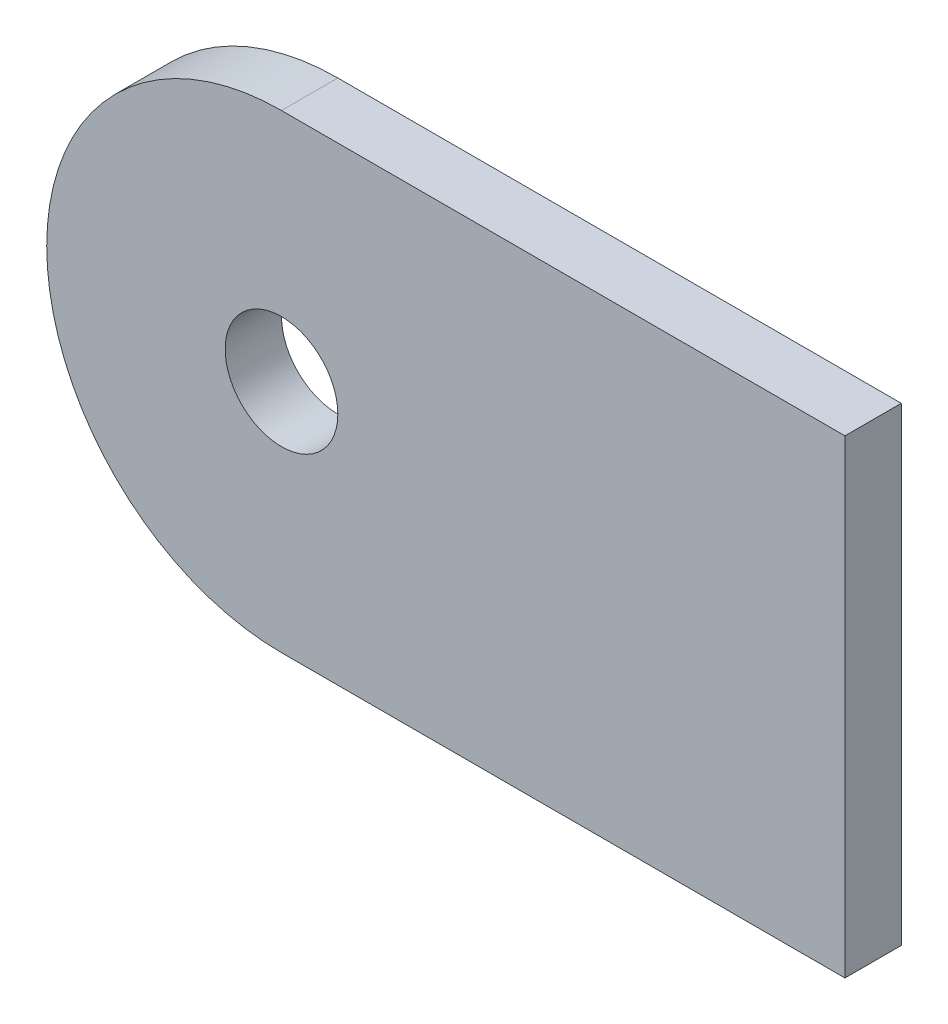
from build123d import *

# Parameters (mm, degrees)
SKETCH1_R           = 3
BOSS_EXTRUDE1_DEPTH = 3


with BuildPart() as part:
    # Sketch1 → Boss-Extrude1 (new body)
    with BuildSketch(Plane.XY.offset(25.797978762)):
        with BuildLine():
            Line((-1.608835655, 3.050715251), (-31.608835655, 3.050715251))
            ThreePointArc((-31.608835655, 3.050715251), (-44.108835655, 15.550715251), (-31.608835655, 28.050715251))
            Line((-31.608835655, 28.050715251), (-1.608835655, 28.050715251))
            Line((-1.608835655, 28.050715251), (-1.608835655, 3.050715251))
        make_face()
        with Locations((-31.608835655, 15.550715251)):
            Circle(SKETCH1_R, mode=Mode.SUBTRACT)
    extrude(amount=BOSS_EXTRUDE1_DEPTH)


solid = part.part
